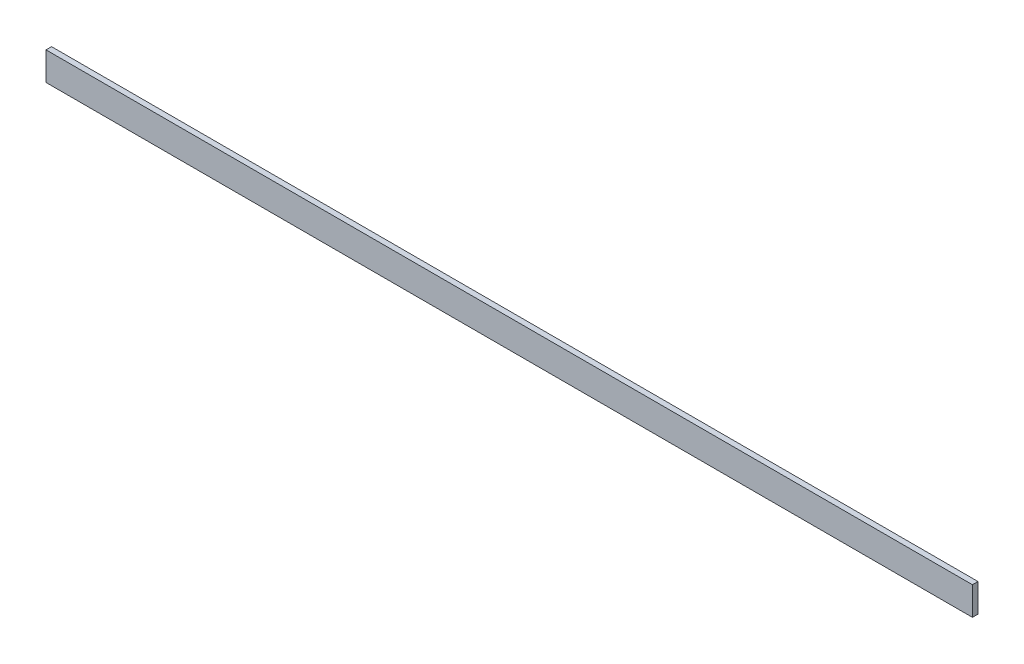
from build123d import *

# Parameters (mm, degrees)
SKETCH1_W           = 1664.295144463
SKETCH1_H           = 50.799
BOSS_EXTRUDE1_DEPTH = 10


with BuildPart() as part:
    # Sketch1 → Boss-Extrude1 (new body)
    with BuildSketch(Plane.XY):
        with Locations((-85.210291915, -262.3815)):
            Rectangle(SKETCH1_W, SKETCH1_H)
    extrude(amount=BOSS_EXTRUDE1_DEPTH)


solid = part.part
